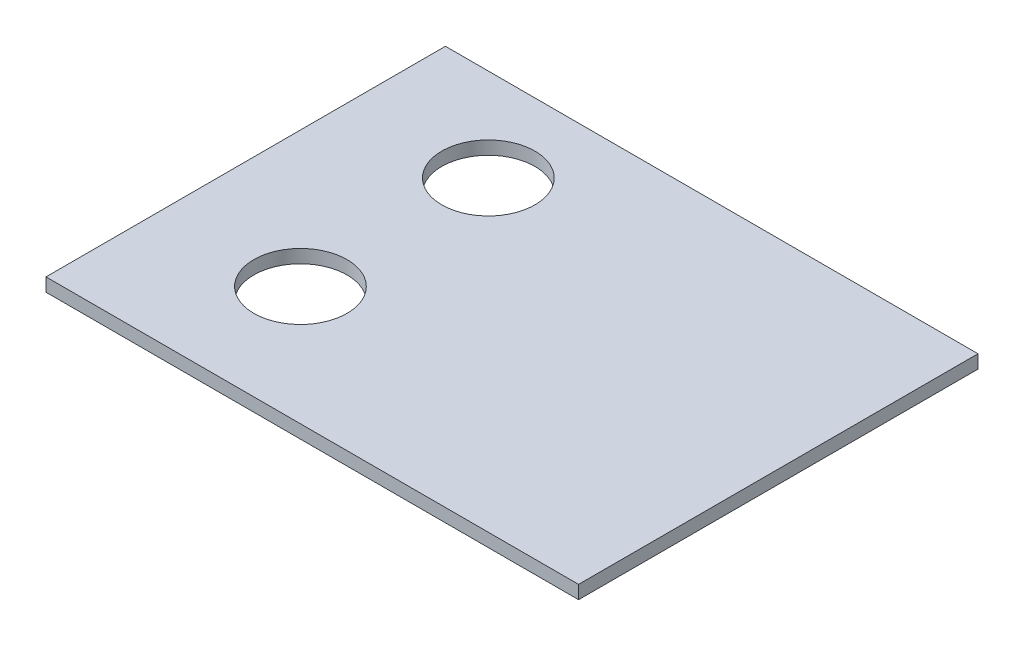
from build123d import *

# Parameters (mm, degrees)
CROQUIS1_W              = 40
CROQUIS1_H              = 30
SALIENTE_EXTRUIR1_DEPTH = 1
CROQUIS2_R              = 3.5
CORTAR_EXTRUIR1_DEPTH   = 10


with BuildPart() as part:
    # Croquis1 → Saliente-Extruir1 (new body)
    with BuildSketch(Plane(origin=(0, 0, 0), x_dir=(1, 0, 0), z_dir=(0, 1, 0))):
        Rectangle(CROQUIS1_W, CROQUIS1_H)
    extrude(amount=SALIENTE_EXTRUIR1_DEPTH)

    # Croquis2 → Cortar-Extruir1 (cut)
    with BuildSketch(Plane(origin=(0, 1, 0), x_dir=(1, 0, 0), z_dir=(0, 1, 0))):
        with Locations((-9.821626601, 8.046092273)):
            Circle(CROQUIS2_R)
        with Locations((-9.821626601, -6.068281882)):
            Circle(CROQUIS2_R)
    extrude(amount=-CORTAR_EXTRUIR1_DEPTH, mode=Mode.SUBTRACT)


solid = part.part
